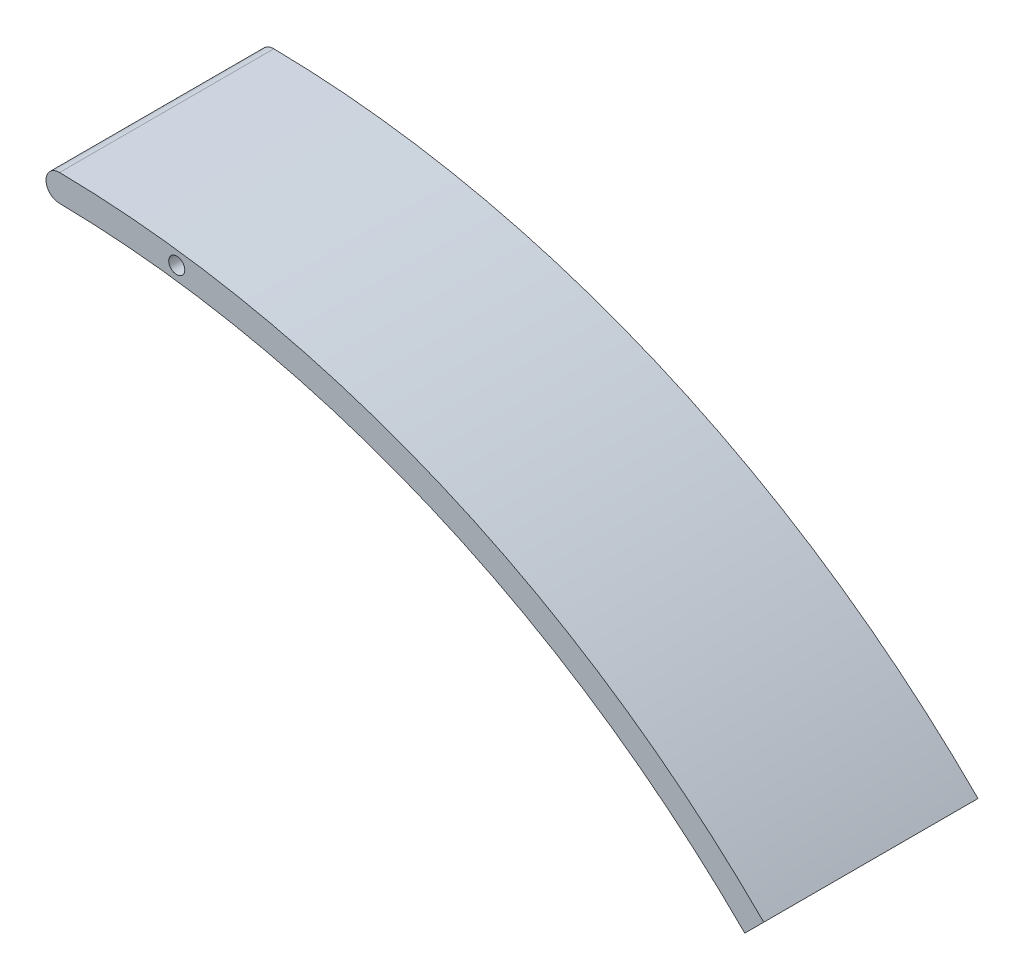
from build123d import *

# Parameters (mm, degrees)
ESQUISSE1_R             = 3
BOSS_EXTRU_1_DEPTH      = 80
CONG_2_R                = 5
ESQUISSE2_W             = 40
ESQUISSE2_H             = 4
ENL_V_MAT_EXTRU_1_DEPTH = 10


with BuildPart() as part:
    # Esquisse1 → Boss.-Extru.1 (new body)
    with BuildSketch(Plane.XY):
        with BuildLine():
            ThreePointArc((0, 379), (145.037020866, 350.150342822), (267.99347007, 267.99347007))
            Line((267.99347007, 267.99347007), (260.922402258, 260.922402258))
            ThreePointArc((260.922402258, 260.922402258), (141.210186543, 340.911547497), (0, 369))
            Line((0, 369), (0, 379))
        make_face()
        with Locations((48.81679589, 370.800378154)):
            Circle(ESQUISSE1_R, mode=Mode.SUBTRACT)
    extrude(amount=BOSS_EXTRU_1_DEPTH)

    # Congé2
    cong_2_edges = [part.edges().sort_by_distance(p)[0] for p in [
        (0, 369, 40),
        (0, 379, 40),
    ]]
    fillet(cong_2_edges, radius=CONG_2_R - 0.0001)  # a hair under: the kernel refuses the full size

    # Esquisse2 → Enlèv. mat.-Extru.1 (cut)
    with BuildSketch(Plane(origin=(0, 0, 0), x_dir=(0, 0, -1), z_dir=(0.7071067811865448, -0.7071067811865503, 0))):
        with Locations((-40, 371)):
            Rectangle(ESQUISSE2_W, ESQUISSE2_H)
    extrude(amount=-ENL_V_MAT_EXTRU_1_DEPTH, mode=Mode.SUBTRACT)


solid = part.part
